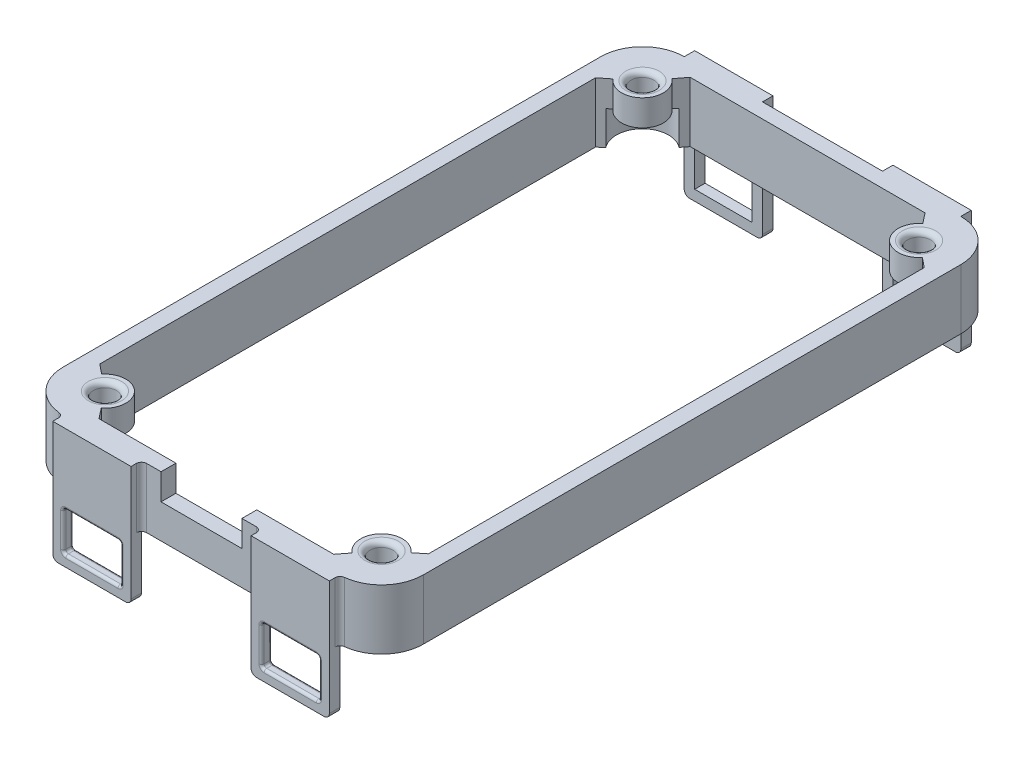
from build123d import *

# Parameters (mm, degrees)
SKETCH1_W           = 65
SKETCH1_H           = 115
SKETCH1_W_2         = 55
SKETCH1_H_2         = 105
BOSS_EXTRUDE1_DEPTH = 23
FILLET1_R           = 6
SKETCH2_R           = 6
BOSS_EXTRUDE2_DEPTH = 23
SKETCH4_R           = 2.2
CUT_EXTRUDE1_DEPTH  = 23
SKETCH7_W           = 55
SKETCH7_H           = 105
CUT_EXTRUDE2_DEPTH  = 13
SKETCH8_W           = 65
SKETCH8_H           = 11.5
CUT_EXTRUDE3_DEPTH  = 120
SKETCH9_R           = 5
CUT_EXTRUDE4_DEPTH  = 6.5
BOSS_EXTRUDE3_DEPTH = 11.5
SKETCH12_W          = 15
SKETCH12_H          = 23
SKETCH12_W_2        = 11
SKETCH12_H_2        = 7.5
BOSS_EXTRUDE4_DEPTH = 2
FILLET2_R           = 1
FILLET3_R           = 0.5
MIRROR12_START      = -61.5
MIRROR12_OUTLINE_W  = 11
MIRROR12_OUTLINE_H  = 7.5
MIRROR12_DEPTH      = 2
SKETCH15_W          = 15.5
SKETCH15_H          = 5
CUT_EXTRUDE5_DEPTH  = 10
CUT_EXTRUDE6_DEPTH  = 72.447533214


# Read off the part's stored shape, not the designer's step: Mirror12
with BuildPart() as part:
    # Sketch1 → Boss-Extrude1 (new body)
    with BuildSketch(Plane(origin=(0, 0, 0), x_dir=(1, 0, 0), z_dir=(0, 1, 0))):
        Rectangle(SKETCH1_W, SKETCH1_H)
        Rectangle(SKETCH1_W_2, SKETCH1_H_2, mode=Mode.SUBTRACT)
    extrude(amount=BOSS_EXTRUDE1_DEPTH)

    # Fillet1
    fillet1_edges = [part.edges().sort_by_distance(p)[0] for p in [
        (32.5, 11.5, 57.5),
        (-32.5, 11.5, 57.5),
        (-32.5, 11.5, -57.5),
        (32.5, 11.5, -57.5),
    ]]
    fillet(fillet1_edges, radius=FILLET1_R)

    # Sketch2 → Boss-Extrude2 (add)
    with BuildSketch(Plane(origin=(0, 23, 0), x_dir=(1, 0, 0), z_dir=(0, 1, 0))):
        with Locations((-26.5, 51.5)):
            Circle(SKETCH2_R)
        with Locations((26.5, 51.5)):
            Circle(SKETCH2_R)
        with Locations((-26.5, -51.5)):
            Circle(SKETCH2_R)
        with Locations((26.5, -51.5)):
            Circle(SKETCH2_R)
    extrude(amount=-BOSS_EXTRUDE2_DEPTH)

    # Sketch4 → Cut-Extrude1 (cut)
    with BuildSketch(Plane(origin=(0, 23, 0), x_dir=(1, 0, 0), z_dir=(0, 1, 0))):
        with Locations(Location((-26.5, 51.5, 0), (0, 0, 270))):
            Circle(SKETCH4_R)
        with Locations(Location((26.5, 51.5, 0), (0, 0, 270))):
            Circle(SKETCH4_R)
        with Locations(Location((26.5, -51.5, 0), (0, 0, 270))):
            Circle(SKETCH4_R)
        with Locations(Location((-26.5, -51.5, 0), (0, 0, 270))):
            Circle(SKETCH4_R)
    extrude(amount=-CUT_EXTRUDE1_DEPTH, mode=Mode.SUBTRACT)

    # Sketch7 → Cut-Extrude2 (cut)
    with BuildSketch(Plane(origin=(0, 18, 0), x_dir=(1, 0, 0), z_dir=(0, 1, 0))):
        Rectangle(SKETCH7_W, SKETCH7_H)
    extrude(amount=-CUT_EXTRUDE2_DEPTH, mode=Mode.SUBTRACT)

    # Sketch8 → Cut-Extrude3 (cut)
    with BuildSketch(Plane.XY.offset(57.5)):
        with Locations((0, 5.75)):
            Rectangle(SKETCH8_W, SKETCH8_H)
    extrude(amount=-CUT_EXTRUDE3_DEPTH, mode=Mode.SUBTRACT)

    # Sketch9 → Cut-Extrude4 (cut)
    with BuildSketch(Plane.XZ.offset(-18)):
        with Locations((-26.5, -51.5)):
            Circle(SKETCH9_R)
        with Locations((26.5, -51.5)):
            Circle(SKETCH9_R)
        with Locations((26.5, 51.5)):
            Circle(SKETCH9_R)
        with Locations((-26.5, 51.5)):
            Circle(SKETCH9_R)
    extrude(amount=CUT_EXTRUDE4_DEPTH, mode=Mode.SUBTRACT)

    # Sketch10 → Boss-Extrude3 (add)
    with BuildSketch(Plane(origin=(0, 23, 0), x_dir=(1, 0, 0), z_dir=(0, 1, 0))):
        with BuildLine():
            Line((-26.5, -59.5), (26.5, -59.5))
            ThreePointArc((26.5, -59.5), (32.156854249, -57.156854249), (34.5, -51.5))
            Line((34.5, -51.5), (34.5, 51.5))
            ThreePointArc((34.5, 51.5), (32.156854249, 57.156854249), (26.5, 59.5))
            Line((26.5, 59.5), (-26.5, 59.5))
            ThreePointArc((-26.5, 59.5), (-32.156854249, 57.156854249), (-34.5, 51.5))
            Line((-34.5, 51.5), (-34.5, -51.5))
            ThreePointArc((-34.5, -51.5), (-32.156854249, -57.156854249), (-26.5, -59.5))
        make_face()
        with BuildLine():
            Line((-26.5, -57.5), (26.5, -57.5))
            ThreePointArc((26.5, -57.5), (30.742640687, -55.742640687), (32.5, -51.5))
            Line((32.5, -51.5), (32.5, 51.5))
            ThreePointArc((32.5, 51.5), (30.742640687, 55.742640687), (26.5, 57.5))
            Line((26.5, 57.5), (-26.5, 57.5))
            ThreePointArc((-26.5, 57.5), (-30.742640687, 55.742640687), (-32.5, 51.5))
            Line((-32.5, 51.5), (-32.5, -51.5))
            ThreePointArc((-32.5, -51.5), (-30.742640687, -55.742640687), (-26.5, -57.5))
        make_face(mode=Mode.SUBTRACT)
    extrude(amount=-BOSS_EXTRUDE3_DEPTH)

    # Sketch12 → Boss-Extrude4 (add)
    # profile 1 of 2: a face of its own
    with BuildSketch(Plane.XY.offset(59.5)):
        with Locations((-19, 11.5)):
            Rectangle(SKETCH12_W, SKETCH12_H)
        with Locations((-19, 5.75)):
            Rectangle(SKETCH12_W_2, SKETCH12_H_2, mode=Mode.SUBTRACT)
    # profile 2 of 2: a face of its own
    with BuildSketch(Plane.XY.offset(59.5)):
        with Locations((19, 11.5)):
            Rectangle(SKETCH12_W, SKETCH12_H)
        with Locations((19, 5.75)):
            Rectangle(SKETCH12_W_2, SKETCH12_H_2, mode=Mode.SUBTRACT)
    extrude(amount=BOSS_EXTRUDE4_DEPTH)

    # Fillet2
    fillet2_edges = [part.edges().sort_by_distance(p)[0] for p in [
        (27.5, 20.5, -45.583920217),
        (20.583920217, 20.5, -52.5),
        (-20.583920217, 20.5, -52.5),
        (-27.5, 20.5, -45.583920217),
        (20.583920217, 20.5, 52.5),
        (27.5, 20.5, 45.583920217),
        (-27.5, 20.5, 45.583920217),
        (-20.583920217, 20.5, 52.5),
        (22.257359313, 18, -47.257359313),
        (27.5, 18, -46.092470366),
        (21.092470366, 18, -52.5),
        (26.5, 18, -53.7),
        (-22.257359313, 18, -47.257359313),
        (-21.092470366, 18, -52.5),
        (-27.5, 18, -46.092470366),
        (-26.5, 18, -53.7),
        (26.5, 18, 49.3),
        (22.257359313, 18, 47.257359313),
        (21.092470366, 18, 52.5),
        (27.5, 18, 46.092470366),
        (-22.257359313, 18, 47.257359313),
        (-27.5, 18, 46.092470366),
        (-21.092470366, 18, 52.5),
        (-26.5, 18, 49.3),
        (11.5, 17.25, 59.5),
        (-11.5, 17.25, 59.5),
        (-26.5, 17.25, 59.5),
        (26.5, 17.25, 59.5),
        (11.5, 0, 60.5),
        (26.5, 0, 60.5),
        (-11.5, 0, 60.5),
        (-26.5, 0, 60.5),
        (26.5, 23, -53.7),
        (-26.5, 23, -53.7),
        (-26.5, 23, 49.3),
        (26.5, 23, 49.3),
    ]]
    fillet(fillet2_edges, radius=FILLET2_R - 0.0001)  # a hair under: the kernel refuses the full size

    # Fillet3
    fillet3_edges = [part.edges().sort_by_distance(p)[0] for p in [
        (-13.5, 5.75, 59.5),
        (-19, 9.5, 59.5),
        (-24.5, 5.75, 59.5),
        (-19, 2, 59.5),
        (-13.5, 5.75, 61.5),
        (-13.5, 9.5, 60.5),
        (-19, 9.5, 61.5),
        (-24.5, 9.5, 60.5),
        (-24.5, 5.75, 61.5),
        (-24.5, 2, 60.5),
        (-19, 2, 61.5),
        (-13.5, 2, 60.5),
        (19, 9.5, 59.5),
        (13.5, 5.75, 59.5),
        (19, 2, 59.5),
        (24.5, 5.75, 59.5),
        (19, 9.5, 61.5),
        (13.5, 9.5, 60.5),
        (13.5, 5.75, 61.5),
        (13.5, 2, 60.5),
        (19, 2, 61.5),
        (24.5, 2, 60.5),
        (24.5, 5.75, 61.5),
        (24.5, 9.5, 60.5),
    ]]
    fillet(fillet3_edges, radius=FILLET3_R)

    # Mirror12 outline → Mirror12 (add)
    # profile 1 of 2: a face of its own
    with BuildSketch(Plane.XY.offset(MIRROR12_START)):
        with BuildLine():
            Line((-11.5, 23), (-26.5, 23))
            Line((-26.5, 23), (-26.5, 1))
            ThreePointArc((-26.5, 1), (-26.207106781, 0.292893219), (-25.5, 0))
            Line((-25.5, 0), (-12.5, 0))
            ThreePointArc((-12.5, 0), (-11.792893219, 0.292893219), (-11.5, 1))
            Line((-11.5, 1), (-11.5, 23))
        make_face()
        with Locations((-19, 5.75)):
            Rectangle(MIRROR12_OUTLINE_W, MIRROR12_OUTLINE_H, mode=Mode.SUBTRACT)
    # profile 2 of 2: a face of its own
    with BuildSketch(Plane.XY.offset(MIRROR12_START)):
        with BuildLine():
            Line((26.5, 23), (11.5, 23))
            Line((11.5, 23), (11.5, 1))
            ThreePointArc((11.5, 1), (11.792893219, 0.292893219), (12.5, 0))
            Line((12.5, 0), (25.5, 0))
            ThreePointArc((25.5, 0), (26.207106781, 0.292893219), (26.5, 1))
            Line((26.5, 1), (26.5, 23))
        make_face()
        with Locations((19, 5.75)):
            Rectangle(MIRROR12_OUTLINE_W, MIRROR12_OUTLINE_H, mode=Mode.SUBTRACT)
    extrude(amount=MIRROR12_DEPTH)

    # Sketch15 → Cut-Extrude5 (cut)
    with BuildSketch(Plane.XY.offset(59.5)):
        with Locations((0, 20.5)):
            Rectangle(SKETCH15_W, SKETCH15_H)
    extrude(amount=-CUT_EXTRUDE5_DEPTH, mode=Mode.SUBTRACT)

    # Sketch16 → Cut-Extrude6 (cut, through all)
    with BuildSketch(Plane.XZ.offset(-11.5)):
        with BuildLine():
            Line((-31.5, 47.5), (-29.623475238, 49.00121981))
            ThreePointArc((-29.623475238, 49.00121981), (-23.651058564, 48.692237066), (-24.046957473, 54.659522489))
            Line((-24.046957473, 54.659522489), (-22.5, 56.652006057))
            Line((-22.5, 56.652006057), (22.5, 56.652006057))
            Line((22.5, 56.652006057), (24.046957473, 54.659522489))
            ThreePointArc((24.046957473, 54.659522489), (23.651058564, 48.692237066), (29.623475238, 49.00121981))
            Line((29.623475238, 49.00121981), (31.5, 47.5))
            Line((31.5, 47.5), (31.5, -47.5))
            Line((31.5, -47.5), (29.623475238, -49.00121981))
            ThreePointArc((29.623475238, -49.00121981), (23.651058564, -48.692237066), (24.046957473, -54.659522489))
            Line((24.046957473, -54.659522489), (22.5, -56.652006057))
            Line((22.5, -56.652006057), (-22.5, -56.652006057))
            Line((-22.5, -56.652006057), (-24.046957473, -54.659522489))
            ThreePointArc((-24.046957473, -54.659522489), (-23.651058564, -48.692237066), (-29.623475238, -49.00121981))
            Line((-29.623475238, -49.00121981), (-31.5, -47.5))
            Line((-31.5, -47.5), (-31.5, 47.5))
        make_face()
    extrude(amount=-CUT_EXTRUDE6_DEPTH, mode=Mode.SUBTRACT)


solid = part.part
